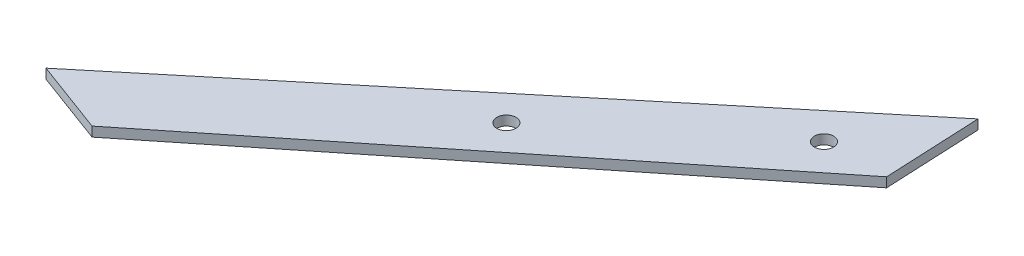
from build123d import *

# Parameters (mm, degrees)
BOSS_EXTRUDE1_DEPTH = 1
CUT_EXTRUDE1_DEPTH  = 1
CUT_EXTRUDE4_DEPTH  = 10
SKETCH5_R           = 1
CUT_EXTRUDE5_DEPTH  = 10
SKETCH7_R           = 1
CUT_EXTRUDE7_DEPTH  = 8


with BuildPart() as part:
    # Sketch1 → Boss-Extrude1 (new body)
    with BuildSketch(Plane(origin=(0, 0, 0), x_dir=(1, 0, 0), z_dir=(0, 1, 0))):
        Polygon((0, 0), (-56.255386196, 20.864599778), (-3.005995602, 64.93045503), align=None)
    extrude(amount=BOSS_EXTRUDE1_DEPTH)

    # Sketch2 → Cut-Extrude1 (cut)
    with BuildSketch(Plane(origin=(0, 1, 0), x_dir=(1, 0, 0), z_dir=(0, 1, 0))):
        with BuildLine():
            Line((0, 0), (-1.157390473, 25))
            ThreePointArc((-1.157390473, 25), (-15.740459818, 21.550060678), (-23.439744248, 8.693583241))
            Line((-23.439744248, 8.693583241), (0, 0))
        make_face()
    extrude(amount=-CUT_EXTRUDE1_DEPTH, mode=Mode.SUBTRACT)

    # Sketch4 → Cut-Extrude4 (cut)
    with BuildSketch(Plane(origin=(0, 1, 0), x_dir=(1, 0, 0), z_dir=(0, 1, 0))):
        Polygon((-34.082996448, 12.64106654), (-1.825264737, 39.426295183), (-2.54284683, 54.926295183), (-48.615637882, 18.031088149), align=None)
    extrude(amount=-CUT_EXTRUDE4_DEPTH, mode=Mode.SUBTRACT)


with BuildPart() as cut_extrude4_kept_piece:
    # of the separate pieces the step leaves, the one the design keeps (cut_extrude4_pieces_kept)
    add(part.part.solids().sort_by_distance((-48.615637882, 0, -18.031088149))[0])

    # Sketch5 → Cut-Extrude5 (cut)
    with BuildSketch(Plane(origin=(0, 1, 0), x_dir=(1, 0, 0), z_dir=(0, 1, 0))):
        with Locations((-27.273283986, 39.95372183)):
            Circle(SKETCH5_R)
    extrude(amount=-CUT_EXTRUDE5_DEPTH, mode=Mode.SUBTRACT)

    # Sketch7 → Cut-Extrude7 (cut)
    with BuildSketch(Plane(origin=(0, 1, 0), x_dir=(1, 0, 0), z_dir=(0, 1, 0))):
        with Locations((-8.993133987, 54.835286196)):
            Circle(SKETCH7_R)
    extrude(amount=-CUT_EXTRUDE7_DEPTH, mode=Mode.SUBTRACT)


solid = cut_extrude4_kept_piece.part
